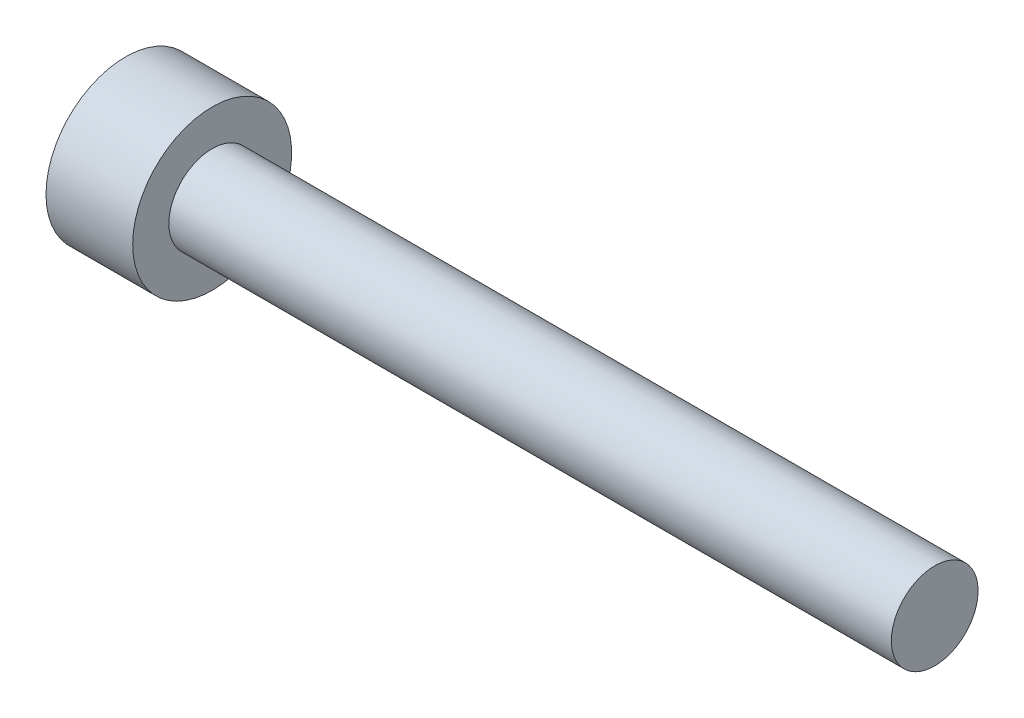
from build123d import *

# Parameters (mm, degrees)
SOCKET_DEPTH = 1.5


with BuildPart() as part:
    # Screw Sketch → Screw (revolve)
    with BuildSketch(Plane.XY):
        Polygon((-3, 0), (-3, 2.75), (0, 2.75), (0, 1.5), (25, 1.5), (25, 0), align=None)
    revolve(axis=Axis((-1000, 0, 0), (1, 0, 0)))

    # Socket Sketch → Socket (cut)
    with BuildSketch(Plane(origin=(-3, 0, 0), x_dir=(0, 0, -1), z_dir=(1, 0, 0))):
        Polygon((1.443375673, 0), (0.721687836, 1.25), (-0.721687836, 1.25), (-1.443375673, 0), (-0.721687836, -1.25), (0.721687836, -1.25), align=None)
    extrude(amount=SOCKET_DEPTH, mode=Mode.SUBTRACT)


solid = part.part
